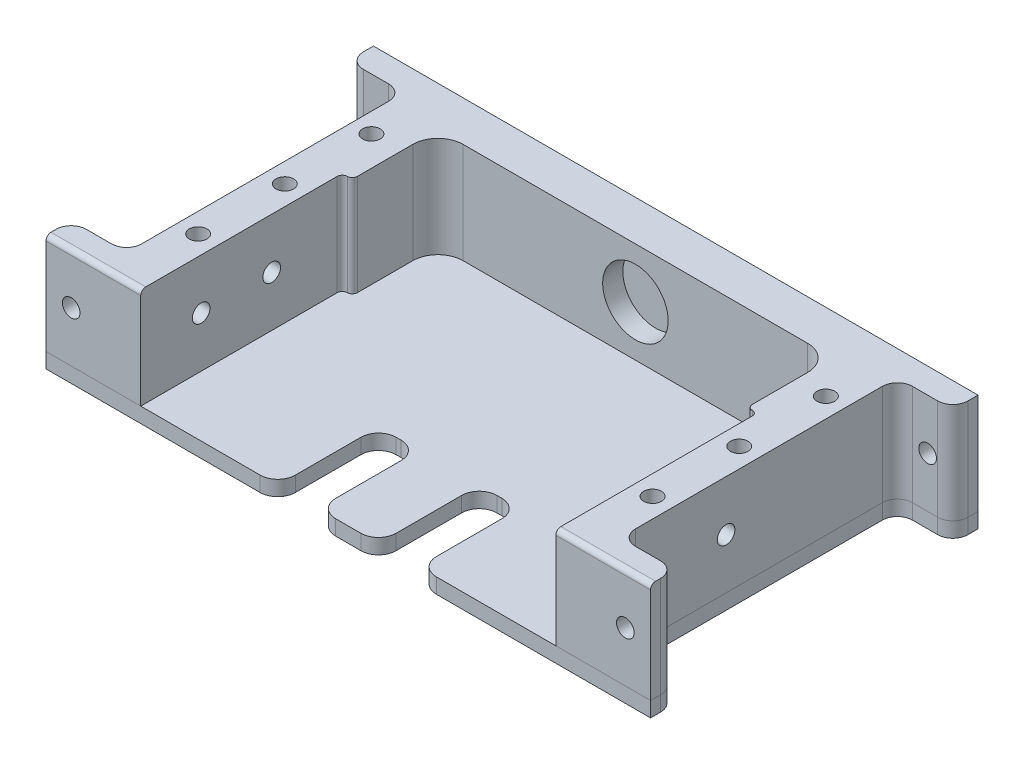
from build123d import *

# Parameters (mm, degrees)
ESQUISSE1_W             = 120
ESQUISSE1_H             = 20
ESQUISSE1_R             = 1.75
BOSS_EXTRU_1_DEPTH      = 65
ENL_V_MAT_EXTRU_1_REACH = 92.692
ESQUISSE2_W             = 11
ESQUISSE2_H             = 55
ESQUISSE2_R             = 1.75
CONG_1_R                = 1
CONG_2_R                = 5
CONG_3_R                = 3
ENL_V_MAT_EXTRU_2_REACH = 129.303
ESQUISSE5_R             = 1.75
ESQUISSE6_R             = 6.5
ENL_V_MAT_EXTRU_3_DEPTH = 4
BOSS_EXTRU_2_DEPTH      = 3
ENL_V_START             = -3
ESQUISSE8_R             = 1.75
ENL_V_MAT_EXTRU_4_DEPTH = 3
CHANFREIN1_SIZE         = 1.5


with BuildPart() as part:
    # Esquisse1 → Boss.-Extru.1 (new body)
    with BuildSketch(Plane.XY):
        Rectangle(ESQUISSE1_W, ESQUISSE1_H)
        with Locations((-55, 0)):
            Circle(ESQUISSE1_R, mode=Mode.SUBTRACT)
        with Locations((55, 0)):
            Circle(ESQUISSE1_R, mode=Mode.SUBTRACT)
    extrude(amount=BOSS_EXTRU_1_DEPTH)

    # Esquisse2 → Enlèv. mat.-Extru.1 (cut, up to next)
    with BuildSketch(Plane(origin=(0, 10, 0), x_dir=(1, 0, 0), z_dir=(0, 1, 0)), mode=Mode.PRIVATE) as enl_v_mat_extru_1_sk1:
        Polygon((-41.2, -25), (-41.2, -65), (41.2, -65), (41.2, -25), (39.2, -25), (39.2, -8), (-39.2, -8), (-39.2, -25), align=None)
    enl_v_mat_extru_1_tool1 = extrude(enl_v_mat_extru_1_sk1.sketch, amount=-ENL_V_MAT_EXTRU_1_REACH, mode=Mode.PRIVATE) & part.part
    # Esquisse2 → Enlèv. mat.-Extru.1 (cut, up to next)
    with BuildSketch(Plane(origin=(0, 10, 0), x_dir=(1, 0, 0), z_dir=(0, 1, 0)), mode=Mode.PRIVATE) as enl_v_mat_extru_1_sk2:
        with Locations((-54.5, -32.5)):
            Rectangle(ESQUISSE2_W, ESQUISSE2_H)
    enl_v_mat_extru_1_tool2 = extrude(enl_v_mat_extru_1_sk2.sketch, amount=-ENL_V_MAT_EXTRU_1_REACH, mode=Mode.PRIVATE) & part.part
    # Esquisse2 → Enlèv. mat.-Extru.1 (cut, up to next)
    with BuildSketch(Plane(origin=(0, 10, 0), x_dir=(1, 0, 0), z_dir=(0, 1, 0)), mode=Mode.PRIVATE) as enl_v_mat_extru_1_sk3:
        with Locations((54.5, -32.5)):
            Rectangle(ESQUISSE2_W, ESQUISSE2_H)
    enl_v_mat_extru_1_tool3 = extrude(enl_v_mat_extru_1_sk3.sketch, amount=-ENL_V_MAT_EXTRU_1_REACH, mode=Mode.PRIVATE) & part.part
    # Esquisse2 → Enlèv. mat.-Extru.1 (cut, up to next)
    with BuildSketch(Plane(origin=(0, 10, 0), x_dir=(1, 0, 0), z_dir=(0, 1, 0)), mode=Mode.PRIVATE) as enl_v_mat_extru_1_sk4:
        with Locations(Location((-45.1, -15.3, 0), (0, 0, 180))):
            Circle(ESQUISSE2_R)
    enl_v_mat_extru_1_tool4 = extrude(enl_v_mat_extru_1_sk4.sketch, amount=-ENL_V_MAT_EXTRU_1_REACH, mode=Mode.PRIVATE) & part.part
    # Esquisse2 → Enlèv. mat.-Extru.1 (cut, up to next)
    with BuildSketch(Plane(origin=(0, 10, 0), x_dir=(1, 0, 0), z_dir=(0, 1, 0)), mode=Mode.PRIVATE) as enl_v_mat_extru_1_sk5:
        with Locations(Location((-45.1, -49.7, 0), (0, 0, 180))):
            Circle(ESQUISSE2_R)
    enl_v_mat_extru_1_tool5 = extrude(enl_v_mat_extru_1_sk5.sketch, amount=-ENL_V_MAT_EXTRU_1_REACH, mode=Mode.PRIVATE) & part.part
    # Esquisse2 → Enlèv. mat.-Extru.1 (cut, up to next)
    with BuildSketch(Plane(origin=(0, 10, 0), x_dir=(1, 0, 0), z_dir=(0, 1, 0)), mode=Mode.PRIVATE) as enl_v_mat_extru_1_sk6:
        with Locations(Location((-45.1, -32.5, 0), (0, 0, 180))):
            Circle(ESQUISSE2_R)
    enl_v_mat_extru_1_tool6 = extrude(enl_v_mat_extru_1_sk6.sketch, amount=-ENL_V_MAT_EXTRU_1_REACH, mode=Mode.PRIVATE) & part.part
    # Esquisse2 → Enlèv. mat.-Extru.1 (cut, up to next)
    with BuildSketch(Plane(origin=(0, 10, 0), x_dir=(1, 0, 0), z_dir=(0, 1, 0)), mode=Mode.PRIVATE) as enl_v_mat_extru_1_sk7:
        with Locations(Location((45.1, -15.3, 0), (0, 0, 180))):
            Circle(ESQUISSE2_R)
    enl_v_mat_extru_1_tool7 = extrude(enl_v_mat_extru_1_sk7.sketch, amount=-ENL_V_MAT_EXTRU_1_REACH, mode=Mode.PRIVATE) & part.part
    # Esquisse2 → Enlèv. mat.-Extru.1 (cut, up to next)
    with BuildSketch(Plane(origin=(0, 10, 0), x_dir=(1, 0, 0), z_dir=(0, 1, 0)), mode=Mode.PRIVATE) as enl_v_mat_extru_1_sk8:
        with Locations(Location((45.1, -32.5, 0), (0, 0, 180))):
            Circle(ESQUISSE2_R)
    enl_v_mat_extru_1_tool8 = extrude(enl_v_mat_extru_1_sk8.sketch, amount=-ENL_V_MAT_EXTRU_1_REACH, mode=Mode.PRIVATE) & part.part
    # Esquisse2 → Enlèv. mat.-Extru.1 (cut, up to next)
    with BuildSketch(Plane(origin=(0, 10, 0), x_dir=(1, 0, 0), z_dir=(0, 1, 0)), mode=Mode.PRIVATE) as enl_v_mat_extru_1_sk9:
        with Locations(Location((45.1, -49.7, 0), (0, 0, 180))):
            Circle(ESQUISSE2_R)
    enl_v_mat_extru_1_tool9 = extrude(enl_v_mat_extru_1_sk9.sketch, amount=-ENL_V_MAT_EXTRU_1_REACH, mode=Mode.PRIVATE) & part.part
    add(enl_v_mat_extru_1_tool1.solids().sort_by_distance((0, 10, 36.793813))[0], mode=Mode.SUBTRACT)
    add(enl_v_mat_extru_1_tool2.solids().sort_by_distance((-54.5, 10, 32.5))[0], mode=Mode.SUBTRACT)
    add(enl_v_mat_extru_1_tool3.solids().sort_by_distance((54.5, 10, 32.5))[0], mode=Mode.SUBTRACT)
    add(enl_v_mat_extru_1_tool4.solids().sort_by_distance((-45.1, 10, 15.3))[0], mode=Mode.SUBTRACT)
    add(enl_v_mat_extru_1_tool5.solids().sort_by_distance((-45.1, 10, 49.7))[0], mode=Mode.SUBTRACT)
    add(enl_v_mat_extru_1_tool6.solids().sort_by_distance((-45.1, 10, 32.5))[0], mode=Mode.SUBTRACT)
    add(enl_v_mat_extru_1_tool7.solids().sort_by_distance((45.1, 10, 15.3))[0], mode=Mode.SUBTRACT)
    add(enl_v_mat_extru_1_tool8.solids().sort_by_distance((45.1, 10, 32.5))[0], mode=Mode.SUBTRACT)
    add(enl_v_mat_extru_1_tool9.solids().sort_by_distance((45.1, 10, 49.7))[0], mode=Mode.SUBTRACT)

    # Congé1
    cong_1_edges = [part.edges().sort_by_distance(p)[0] for p in [
        (50.6, 10, 65),
        (-50.6, 10, 65),
        (-41.2, 0, 25),
        (-39.2, 0, 25),
        (41.2, 0, 25),
        (39.2, 0, 25),
    ]]
    fillet(cong_1_edges, radius=CONG_1_R - 0.0001)  # a hair under: the kernel refuses the full size

    # Congé2
    cong_2_edges = [part.edges().sort_by_distance(p)[0] for p in [
        (-39.2, 0, 8),
        (39.2, 0, 8),
    ]]
    fillet(cong_2_edges, radius=CONG_2_R)

    # Congé3
    cong_3_edges = [part.edges().sort_by_distance(p)[0] for p in [
        (49, 0, 60),
        (49, 0, 5),
        (60, 0, 5),
        (60, 0, 60),
        (-49, 0, 5),
        (-49, 0, 60),
        (-60, 0, 60),
        (-60, 0, 5),
    ]]
    fillet(cong_3_edges, radius=CONG_3_R)

    # Enlèv. mat.-Extru.2: up to this face of the body (flat: up to its plane)
    enl_v_mat_extru_2_end = Plane(part.part.faces().sort_by_distance((-49, 0, 32.5))[0])
    # Esquisse5 → Enlèv. mat.-Extru.2 (cut, up to the picked face)
    with BuildSketch(Plane(origin=(49, 0, 0), x_dir=(0, 0, -1), z_dir=(1, 0, 0)), mode=Mode.PRIVATE) as enl_v_mat_extru_2_sk1:
        with Locations(Location((-53, 0, 0), (0, 0, 90))):
            Circle(ESQUISSE5_R)
    enl_v_mat_extru_2_tool1 = split(extrude(enl_v_mat_extru_2_sk1.sketch, amount=-ENL_V_MAT_EXTRU_2_REACH, mode=Mode.PRIVATE), bisect_by=enl_v_mat_extru_2_end, keep=Keep.BOTH, mode=Mode.PRIVATE)
    # Esquisse5 → Enlèv. mat.-Extru.2 (cut, up to the picked face)
    with BuildSketch(Plane(origin=(49, 0, 0), x_dir=(0, 0, -1), z_dir=(1, 0, 0)), mode=Mode.PRIVATE) as enl_v_mat_extru_2_sk2:
        with Locations(Location((-39, 0, 0), (0, 0, 90))):
            Circle(ESQUISSE5_R)
    enl_v_mat_extru_2_tool2 = split(extrude(enl_v_mat_extru_2_sk2.sketch, amount=-ENL_V_MAT_EXTRU_2_REACH, mode=Mode.PRIVATE), bisect_by=enl_v_mat_extru_2_end, keep=Keep.BOTH, mode=Mode.PRIVATE)
    add(enl_v_mat_extru_2_tool1.solids().sort_by(Axis((49, 0, 53), (-1, 0, 0)))[0], mode=Mode.SUBTRACT)
    add(enl_v_mat_extru_2_tool2.solids().sort_by(Axis((49, 0, 39), (-1, 0, 0)))[0], mode=Mode.SUBTRACT)

    # Esquisse6 → Enlèv. mat.-Extru.3 (cut)
    with BuildSketch(Plane.XY.offset(8)):
        Circle(ESQUISSE6_R)
    extrude(amount=-ENL_V_MAT_EXTRU_3_DEPTH, mode=Mode.SUBTRACT)


with BuildPart() as body_2:
    # Esquisse7 → Boss.-Extru.2 (new body)
    with BuildSketch(Plane.XZ.offset(10)):
        with BuildLine():
            Line((6, 48.5), (6, 61.5))
            ThreePointArc((6, 61.5), (4.974873734, 63.974873734), (2.5, 65))
            Line((2.5, 65), (-2.5, 65))
            ThreePointArc((-2.5, 65), (-4.974873734, 63.974873734), (-6, 61.5))
            Line((-6, 61.5), (-6, 48.5))
            ThreePointArc((-6, 48.5), (-7.025126266, 46.025126266), (-9.5, 45))
            Line((-9.5, 45), (-10.5, 45))
            ThreePointArc((-10.5, 45), (-12.974873734, 46.025126266), (-14, 48.5))
            Line((-14, 48.5), (-14, 61.5))
            ThreePointArc((-14, 61.5), (-15.025126266, 63.974873734), (-17.5, 65))
            Line((-17.5, 65), (-60, 65))
            Line((-60, 65), (-60, 63))
            ThreePointArc((-60, 63), (-59.121320344, 60.878679656), (-57, 60))
            Line((-57, 60), (-52, 60))
            ThreePointArc((-52, 60), (-49.878679656, 59.121320344), (-49, 57))
            Line((-49, 57), (-49, 8))
            ThreePointArc((-49, 8), (-49.878679656, 5.878679656), (-52, 5))
            Line((-52, 5), (-57, 5))
            ThreePointArc((-57, 5), (-59.121320344, 4.121320344), (-60, 2))
            Line((-60, 2), (-60, 0))
            Line((-60, 0), (60, 0))
            Line((60, 0), (60, 2))
            ThreePointArc((60, 2), (59.121320344, 4.121320344), (57, 5))
            Line((57, 5), (52, 5))
            ThreePointArc((52, 5), (49.878679656, 5.878679656), (49, 8))
            Line((49, 8), (49, 57))
            ThreePointArc((49, 57), (49.878679656, 59.121320344), (52, 60))
            Line((52, 60), (57, 60))
            ThreePointArc((57, 60), (59.121320344, 60.878679656), (60, 63))
            Line((60, 63), (60, 65))
            Line((60, 65), (17.5, 65))
            ThreePointArc((17.5, 65), (15.025126266, 63.974873734), (14, 61.5))
            Line((14, 61.5), (14, 48.5))
            ThreePointArc((14, 48.5), (12.974873734, 46.025126266), (10.5, 45))
            Line((10.5, 45), (9.5, 45))
            ThreePointArc((9.5, 45), (7.025126266, 46.025126266), (6, 48.5))
        make_face()
    extrude(amount=BOSS_EXTRU_2_DEPTH)

    # Esquisse8 → Enlèv. mat.-Extru.4 (cut)
    with BuildSketch(Plane.XZ.offset(13).offset(ENL_V_START)):
        with Locations((-45.1, 15.3)):
            Circle(ESQUISSE8_R)
        with Locations((-45.1, 32.5)):
            Circle(ESQUISSE8_R)
        with Locations((-45.1, 49.7)):
            Circle(ESQUISSE8_R)
        with Locations((45.1, 49.7)):
            Circle(ESQUISSE8_R)
        with Locations((45.1, 32.5)):
            Circle(ESQUISSE8_R)
        with Locations((45.1, 15.3)):
            Circle(ESQUISSE8_R)
    extrude(amount=ENL_V_MAT_EXTRU_4_DEPTH, mode=Mode.SUBTRACT)

    # Chanfrein1
    chanfrein1_edges = [body_2.edges().sort_by_distance(p)[0] for p in [
        (43.35, -13, 15.3),
        (43.35, -13, 49.7),
        (-46.85, -13, 49.7),
        (-46.85, -13, 15.3),
    ]]
    chamfer(chanfrein1_edges, length=CHANFREIN1_SIZE)


solid = Compound([part.part, body_2.part])
